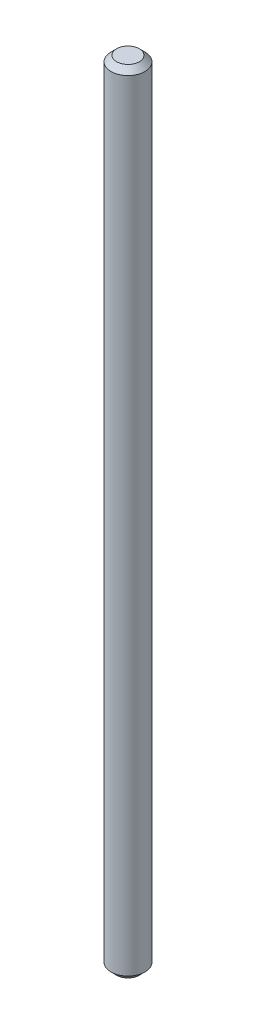
from build123d import *

# Parameters (mm, degrees)
SKETCH1_R           = 3
BOSS_EXTRUDE1_DEPTH = 140
CHAMFER1_SIZE       = 1


with BuildPart() as part:
    # Sketch1 → Boss-Extrude1 (new body)
    with BuildSketch(Plane(origin=(0, 0, 0), x_dir=(1, 0, 0), z_dir=(0, 1, 0))):
        Circle(SKETCH1_R)
    extrude(amount=BOSS_EXTRUDE1_DEPTH)

    # Chamfer1
    chamfer1_edges = [part.edges().sort_by_distance(p)[0] for p in [
        (-3, 0, 0),
        (-3, 140, 0),
    ]]
    chamfer(chamfer1_edges, length=CHAMFER1_SIZE)


solid = part.part
